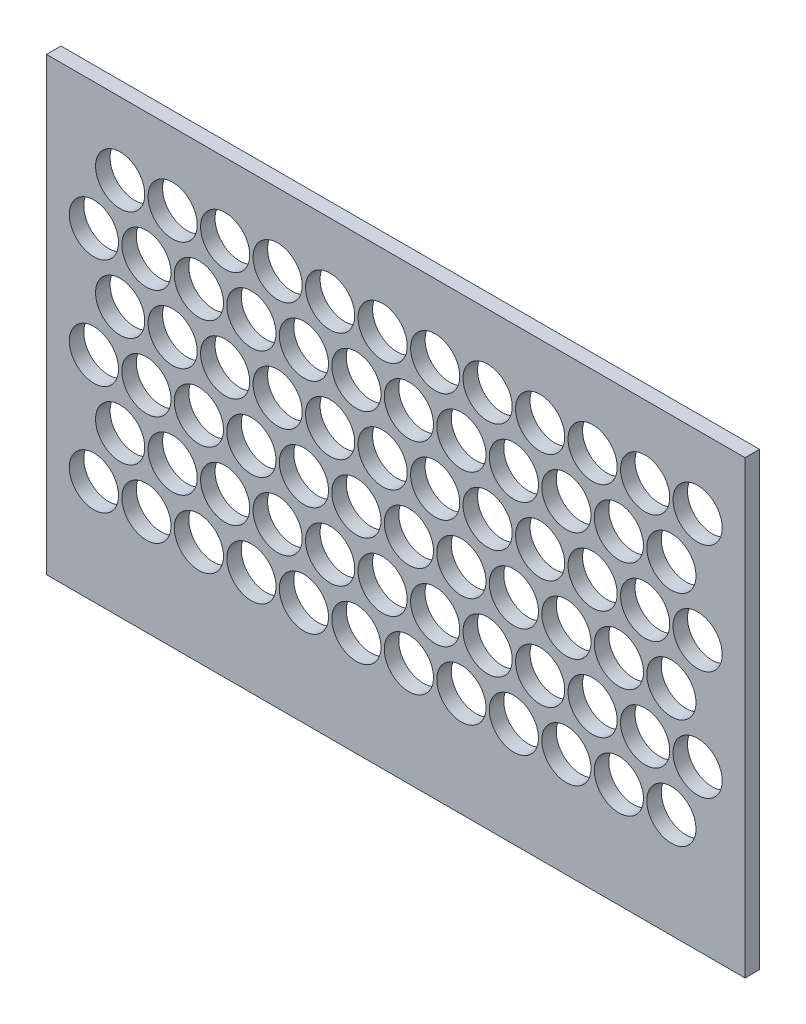
from build123d import *

# Parameters (mm, degrees)
SKETCH1_W                  = 306.05000007
SKETCH1_H                  = 197.4250001
BOSS_EXTRUDE1_DEPTH        = 6.35
CUT_EXTRUDE1_DEPTH         = 187.132543615
SKETCH4_R                  = 10.775
CUT_EXTRUDE2_DEPTH         = 187.132543615
LPATTERN1_COUNT            = 12
LPATTERN1_PITCH            = 23
LPATTERN2_COPY_1_DEPTH     = 187.132543615
LPATTERN2_COPY_2_DEPTH     = 187.132543615
LPATTERN2_COPY_3_DEPTH     = 187.132543615
LPATTERN2_COPY_4_DEPTH     = 187.132543615
LPATTERN2_COPY_5_DEPTH     = 187.132543615
LPATTERN2_COPY_6_DEPTH     = 187.132543615
LPATTERN2_COPY_7_DEPTH     = 187.132543615
LPATTERN2_COPY_8_DEPTH     = 187.132543615
LPATTERN2_COPY_9_DEPTH     = 187.132543615
LPATTERN2_COPY_10_DEPTH    = 187.132543615
LPATTERN2_COPY_11_DEPTH    = 187.132543615
LPATTERN2_COPY_12_DEPTH    = 187.132543615
LPATTERN2_COPY_13_DEPTH    = 187.132543615
LPATTERN2_COPY_14_DEPTH    = 187.132543615
LPATTERN2_COPY_15_DEPTH    = 187.132543615
LPATTERN2_COPY_16_DEPTH    = 187.132543615
LPATTERN2_COPY_17_DEPTH    = 187.132543615
LPATTERN2_COPY_18_DEPTH    = 187.132543615
LPATTERN2_COPY_19_DEPTH    = 187.132543615
LPATTERN2_COPY_20_DEPTH    = 187.132543615
LPATTERN2_COPY_21_DEPTH    = 187.132543615
LPATTERN2_COPY_22_DEPTH    = 187.132543615
LPATTERN2_COPY_23_SKETCH_R = 10.775
LPATTERN2_COPY_23_DEPTH    = 187.132543615
LPATTERN2_COPY_24_SKETCH_R = 10.775
LPATTERN2_COPY_24_DEPTH    = 187.132543615
LPATTERN2_COPY_25_SKETCH_R = 10.775
LPATTERN2_COPY_25_DEPTH    = 187.132543615
LPATTERN2_COPY_26_SKETCH_R = 10.775
LPATTERN2_COPY_26_DEPTH    = 187.132543615
LPATTERN2_COPY_27_SKETCH_R = 10.775
LPATTERN2_COPY_27_DEPTH    = 187.132543615
LPATTERN2_COPY_28_SKETCH_R = 10.775
LPATTERN2_COPY_28_DEPTH    = 187.132543615
LPATTERN2_COPY_29_SKETCH_R = 10.775
LPATTERN2_COPY_29_DEPTH    = 187.132543615
LPATTERN2_COPY_30_SKETCH_R = 10.775
LPATTERN2_COPY_30_DEPTH    = 187.132543615
LPATTERN2_COPY_31_SKETCH_R = 10.775
LPATTERN2_COPY_31_DEPTH    = 187.132543615
LPATTERN2_COPY_32_SKETCH_R = 10.775
LPATTERN2_COPY_32_DEPTH    = 187.132543615
LPATTERN2_COPY_33_SKETCH_R = 10.775
LPATTERN2_COPY_33_DEPTH    = 187.132543615
LPATTERN2_COPY_34_SKETCH_R = 10.775
LPATTERN2_COPY_34_DEPTH    = 187.132543615
LPATTERN2_COPY_35_SKETCH_R = 10.775
LPATTERN2_COPY_35_DEPTH    = 187.132543615
LPATTERN2_COPY_36_SKETCH_R = 10.775
LPATTERN2_COPY_36_DEPTH    = 187.132543615
LPATTERN2_COPY_37_SKETCH_R = 10.775
LPATTERN2_COPY_37_DEPTH    = 187.132543615
LPATTERN2_COPY_38_SKETCH_R = 10.775
LPATTERN2_COPY_38_DEPTH    = 187.132543615
LPATTERN2_COPY_39_SKETCH_R = 10.775
LPATTERN2_COPY_39_DEPTH    = 187.132543615
LPATTERN2_COPY_40_SKETCH_R = 10.775
LPATTERN2_COPY_40_DEPTH    = 187.132543615
LPATTERN2_COPY_41_SKETCH_R = 10.775
LPATTERN2_COPY_41_DEPTH    = 187.132543615
LPATTERN2_COPY_42_SKETCH_R = 10.775
LPATTERN2_COPY_42_DEPTH    = 187.132543615
LPATTERN2_COPY_43_SKETCH_R = 10.775
LPATTERN2_COPY_43_DEPTH    = 187.132543615
LPATTERN2_COPY_44_SKETCH_R = 10.775
LPATTERN2_COPY_44_DEPTH    = 187.132543615
LPATTERN2_COPY_45_DEPTH    = 187.132543615
LPATTERN2_COPY_46_DEPTH    = 187.132543615
LPATTERN2_COPY_47_SKETCH_R = 10.775
LPATTERN2_COPY_47_DEPTH    = 187.132543615
LPATTERN2_COPY_48_SKETCH_R = 10.775
LPATTERN2_COPY_48_DEPTH    = 187.132543615


with BuildPart() as part:
    # Sketch1 → Boss-Extrude1 (new body)
    with BuildSketch(Plane.XY):
        with Locations((3.5e-08, -7.06250005)):
            Rectangle(SKETCH1_W, SKETCH1_H)
    extrude(amount=BOSS_EXTRUDE1_DEPTH)

    # Sketch3 → Cut-Extrude1 (cut, through all)
    with BuildSketch(Plane.XY.offset(6.35)):
        with BuildLine():
            ThreePointArc((-121.475, -60), (-132.24999993, -49.225), (-143.025, -59.999999859))
            ThreePointArc((-143.025, -59.999999859), (-139.869075617, -67.619075517), (-132.25, -70.775))
            ThreePointArc((-132.25, -70.775), (-124.630924433, -67.619075567), (-121.475, -60))
        make_face()
    cut_extrude1 = extrude(amount=-CUT_EXTRUDE1_DEPTH, mode=Mode.SUBTRACT)

    # Sketch4 → Cut-Extrude2 (cut, through all)
    with BuildSketch(Plane.XY.offset(6.35)):
        with Locations((-120.75, -36)):
            Circle(SKETCH4_R)
    cut_extrude2 = extrude(amount=-CUT_EXTRUDE2_DEPTH, mode=Mode.SUBTRACT)

    # LPattern1: Cut-Extrude1, Cut-Extrude2 ×12
    with Locations(*[(i * LPATTERN1_PITCH, 0, 0) for i in range(1, LPATTERN1_COUNT)]):
        add(cut_extrude1, mode=Mode.SUBTRACT)
        add(cut_extrude2, mode=Mode.SUBTRACT)

    # LPattern2 copy 1 sketch → LPattern2 copy 1 (cut, through all)
    with BuildSketch(Plane(origin=(23, 48, 6.35), x_dir=(1, 0, 0), z_dir=(0, 0, 1))):
        with BuildLine():
            ThreePointArc((-121.475, -60), (-132.24999993, -49.225), (-143.025, -59.999999859))
            ThreePointArc((-143.025, -59.999999859), (-139.869075617, -67.619075517), (-132.25, -70.775))
            ThreePointArc((-132.25, -70.775), (-124.630924433, -67.619075567), (-121.475, -60))
        make_face()
    extrude(amount=-LPATTERN2_COPY_1_DEPTH, mode=Mode.SUBTRACT)

    # LPattern2 copy 2 sketch → LPattern2 copy 2 (cut, through all)
    with BuildSketch(Plane(origin=(23, 96, 6.35), x_dir=(1, 0, 0), z_dir=(0, 0, 1))):
        with BuildLine():
            ThreePointArc((-121.475, -60), (-132.24999993, -49.225), (-143.025, -59.999999859))
            ThreePointArc((-143.025, -59.999999859), (-139.869075617, -67.619075517), (-132.25, -70.775))
            ThreePointArc((-132.25, -70.775), (-124.630924433, -67.619075567), (-121.475, -60))
        make_face()
    extrude(amount=-LPATTERN2_COPY_2_DEPTH, mode=Mode.SUBTRACT)

    # LPattern2 copy 3 sketch → LPattern2 copy 3 (cut, through all)
    with BuildSketch(Plane(origin=(46, 48, 6.35), x_dir=(1, 0, 0), z_dir=(0, 0, 1))):
        with BuildLine():
            ThreePointArc((-121.475, -60), (-132.24999993, -49.225), (-143.025, -59.999999859))
            ThreePointArc((-143.025, -59.999999859), (-139.869075617, -67.619075517), (-132.25, -70.775))
            ThreePointArc((-132.25, -70.775), (-124.630924433, -67.619075567), (-121.475, -60))
        make_face()
    extrude(amount=-LPATTERN2_COPY_3_DEPTH, mode=Mode.SUBTRACT)

    # LPattern2 copy 4 sketch → LPattern2 copy 4 (cut, through all)
    with BuildSketch(Plane(origin=(46, 96, 6.35), x_dir=(1, 0, 0), z_dir=(0, 0, 1))):
        with BuildLine():
            ThreePointArc((-121.475, -60), (-132.24999993, -49.225), (-143.025, -59.999999859))
            ThreePointArc((-143.025, -59.999999859), (-139.869075617, -67.619075517), (-132.25, -70.775))
            ThreePointArc((-132.25, -70.775), (-124.630924433, -67.619075567), (-121.475, -60))
        make_face()
    extrude(amount=-LPATTERN2_COPY_4_DEPTH, mode=Mode.SUBTRACT)

    # LPattern2 copy 5 sketch → LPattern2 copy 5 (cut, through all)
    with BuildSketch(Plane(origin=(69, 48, 6.35), x_dir=(1, 0, 0), z_dir=(0, 0, 1))):
        with BuildLine():
            ThreePointArc((-121.475, -60), (-132.24999993, -49.225), (-143.025, -59.999999859))
            ThreePointArc((-143.025, -59.999999859), (-139.869075617, -67.619075517), (-132.25, -70.775))
            ThreePointArc((-132.25, -70.775), (-124.630924433, -67.619075567), (-121.475, -60))
        make_face()
    extrude(amount=-LPATTERN2_COPY_5_DEPTH, mode=Mode.SUBTRACT)

    # LPattern2 copy 6 sketch → LPattern2 copy 6 (cut, through all)
    with BuildSketch(Plane(origin=(69, 96, 6.35), x_dir=(1, 0, 0), z_dir=(0, 0, 1))):
        with BuildLine():
            ThreePointArc((-121.475, -60), (-132.24999993, -49.225), (-143.025, -59.999999859))
            ThreePointArc((-143.025, -59.999999859), (-139.869075617, -67.619075517), (-132.25, -70.775))
            ThreePointArc((-132.25, -70.775), (-124.630924433, -67.619075567), (-121.475, -60))
        make_face()
    extrude(amount=-LPATTERN2_COPY_6_DEPTH, mode=Mode.SUBTRACT)

    # LPattern2 copy 7 sketch → LPattern2 copy 7 (cut, through all)
    with BuildSketch(Plane(origin=(92, 48, 6.35), x_dir=(1, 0, 0), z_dir=(0, 0, 1))):
        with BuildLine():
            ThreePointArc((-121.475, -60), (-132.24999993, -49.225), (-143.025, -59.999999859))
            ThreePointArc((-143.025, -59.999999859), (-139.869075617, -67.619075517), (-132.25, -70.775))
            ThreePointArc((-132.25, -70.775), (-124.630924433, -67.619075567), (-121.475, -60))
        make_face()
    extrude(amount=-LPATTERN2_COPY_7_DEPTH, mode=Mode.SUBTRACT)

    # LPattern2 copy 8 sketch → LPattern2 copy 8 (cut, through all)
    with BuildSketch(Plane(origin=(92, 96, 6.35), x_dir=(1, 0, 0), z_dir=(0, 0, 1))):
        with BuildLine():
            ThreePointArc((-121.475, -60), (-132.24999993, -49.225), (-143.025, -59.999999859))
            ThreePointArc((-143.025, -59.999999859), (-139.869075617, -67.619075517), (-132.25, -70.775))
            ThreePointArc((-132.25, -70.775), (-124.630924433, -67.619075567), (-121.475, -60))
        make_face()
    extrude(amount=-LPATTERN2_COPY_8_DEPTH, mode=Mode.SUBTRACT)

    # LPattern2 copy 9 sketch → LPattern2 copy 9 (cut, through all)
    with BuildSketch(Plane(origin=(115, 48, 6.35), x_dir=(1, 0, 0), z_dir=(0, 0, 1))):
        with BuildLine():
            ThreePointArc((-121.475, -60), (-132.24999993, -49.225), (-143.025, -59.999999859))
            ThreePointArc((-143.025, -59.999999859), (-139.869075617, -67.619075517), (-132.25, -70.775))
            ThreePointArc((-132.25, -70.775), (-124.630924433, -67.619075567), (-121.475, -60))
        make_face()
    extrude(amount=-LPATTERN2_COPY_9_DEPTH, mode=Mode.SUBTRACT)

    # LPattern2 copy 10 sketch → LPattern2 copy 10 (cut, through all)
    with BuildSketch(Plane(origin=(115, 96, 6.35), x_dir=(1, 0, 0), z_dir=(0, 0, 1))):
        with BuildLine():
            ThreePointArc((-121.475, -60), (-132.24999993, -49.225), (-143.025, -59.999999859))
            ThreePointArc((-143.025, -59.999999859), (-139.869075617, -67.619075517), (-132.25, -70.775))
            ThreePointArc((-132.25, -70.775), (-124.630924433, -67.619075567), (-121.475, -60))
        make_face()
    extrude(amount=-LPATTERN2_COPY_10_DEPTH, mode=Mode.SUBTRACT)

    # LPattern2 copy 11 sketch → LPattern2 copy 11 (cut, through all)
    with BuildSketch(Plane(origin=(138, 48, 6.35), x_dir=(1, 0, 0), z_dir=(0, 0, 1))):
        with BuildLine():
            ThreePointArc((-121.475, -60), (-132.24999993, -49.225), (-143.025, -59.999999859))
            ThreePointArc((-143.025, -59.999999859), (-139.869075617, -67.619075517), (-132.25, -70.775))
            ThreePointArc((-132.25, -70.775), (-124.630924433, -67.619075567), (-121.475, -60))
        make_face()
    extrude(amount=-LPATTERN2_COPY_11_DEPTH, mode=Mode.SUBTRACT)

    # LPattern2 copy 12 sketch → LPattern2 copy 12 (cut, through all)
    with BuildSketch(Plane(origin=(138, 96, 6.35), x_dir=(1, 0, 0), z_dir=(0, 0, 1))):
        with BuildLine():
            ThreePointArc((-121.475, -60), (-132.24999993, -49.225), (-143.025, -59.999999859))
            ThreePointArc((-143.025, -59.999999859), (-139.869075617, -67.619075517), (-132.25, -70.775))
            ThreePointArc((-132.25, -70.775), (-124.630924433, -67.619075567), (-121.475, -60))
        make_face()
    extrude(amount=-LPATTERN2_COPY_12_DEPTH, mode=Mode.SUBTRACT)

    # LPattern2 copy 13 sketch → LPattern2 copy 13 (cut, through all)
    with BuildSketch(Plane(origin=(161, 48, 6.35), x_dir=(1, 0, 0), z_dir=(0, 0, 1))):
        with BuildLine():
            ThreePointArc((-121.475, -60), (-132.24999993, -49.225), (-143.025, -59.999999859))
            ThreePointArc((-143.025, -59.999999859), (-139.869075617, -67.619075517), (-132.25, -70.775))
            ThreePointArc((-132.25, -70.775), (-124.630924433, -67.619075567), (-121.475, -60))
        make_face()
    extrude(amount=-LPATTERN2_COPY_13_DEPTH, mode=Mode.SUBTRACT)

    # LPattern2 copy 14 sketch → LPattern2 copy 14 (cut, through all)
    with BuildSketch(Plane(origin=(161, 96, 6.35), x_dir=(1, 0, 0), z_dir=(0, 0, 1))):
        with BuildLine():
            ThreePointArc((-121.475, -60), (-132.24999993, -49.225), (-143.025, -59.999999859))
            ThreePointArc((-143.025, -59.999999859), (-139.869075617, -67.619075517), (-132.25, -70.775))
            ThreePointArc((-132.25, -70.775), (-124.630924433, -67.619075567), (-121.475, -60))
        make_face()
    extrude(amount=-LPATTERN2_COPY_14_DEPTH, mode=Mode.SUBTRACT)

    # LPattern2 copy 15 sketch → LPattern2 copy 15 (cut, through all)
    with BuildSketch(Plane(origin=(184, 48, 6.35), x_dir=(1, 0, 0), z_dir=(0, 0, 1))):
        with BuildLine():
            ThreePointArc((-121.475, -60), (-132.24999993, -49.225), (-143.025, -59.999999859))
            ThreePointArc((-143.025, -59.999999859), (-139.869075617, -67.619075517), (-132.25, -70.775))
            ThreePointArc((-132.25, -70.775), (-124.630924433, -67.619075567), (-121.475, -60))
        make_face()
    extrude(amount=-LPATTERN2_COPY_15_DEPTH, mode=Mode.SUBTRACT)

    # LPattern2 copy 16 sketch → LPattern2 copy 16 (cut, through all)
    with BuildSketch(Plane(origin=(184, 96, 6.35), x_dir=(1, 0, 0), z_dir=(0, 0, 1))):
        with BuildLine():
            ThreePointArc((-121.475, -60), (-132.24999993, -49.225), (-143.025, -59.999999859))
            ThreePointArc((-143.025, -59.999999859), (-139.869075617, -67.619075517), (-132.25, -70.775))
            ThreePointArc((-132.25, -70.775), (-124.630924433, -67.619075567), (-121.475, -60))
        make_face()
    extrude(amount=-LPATTERN2_COPY_16_DEPTH, mode=Mode.SUBTRACT)

    # LPattern2 copy 17 sketch → LPattern2 copy 17 (cut, through all)
    with BuildSketch(Plane(origin=(207, 48, 6.35), x_dir=(1, 0, 0), z_dir=(0, 0, 1))):
        with BuildLine():
            ThreePointArc((-121.475, -60), (-132.24999993, -49.225), (-143.025, -59.999999859))
            ThreePointArc((-143.025, -59.999999859), (-139.869075617, -67.619075517), (-132.25, -70.775))
            ThreePointArc((-132.25, -70.775), (-124.630924433, -67.619075567), (-121.475, -60))
        make_face()
    extrude(amount=-LPATTERN2_COPY_17_DEPTH, mode=Mode.SUBTRACT)

    # LPattern2 copy 18 sketch → LPattern2 copy 18 (cut, through all)
    with BuildSketch(Plane(origin=(207, 96, 6.35), x_dir=(1, 0, 0), z_dir=(0, 0, 1))):
        with BuildLine():
            ThreePointArc((-121.475, -60), (-132.24999993, -49.225), (-143.025, -59.999999859))
            ThreePointArc((-143.025, -59.999999859), (-139.869075617, -67.619075517), (-132.25, -70.775))
            ThreePointArc((-132.25, -70.775), (-124.630924433, -67.619075567), (-121.475, -60))
        make_face()
    extrude(amount=-LPATTERN2_COPY_18_DEPTH, mode=Mode.SUBTRACT)

    # LPattern2 copy 19 sketch → LPattern2 copy 19 (cut, through all)
    with BuildSketch(Plane(origin=(230, 48, 6.35), x_dir=(1, 0, 0), z_dir=(0, 0, 1))):
        with BuildLine():
            ThreePointArc((-121.475, -60), (-132.24999993, -49.225), (-143.025, -59.999999859))
            ThreePointArc((-143.025, -59.999999859), (-139.869075617, -67.619075517), (-132.25, -70.775))
            ThreePointArc((-132.25, -70.775), (-124.630924433, -67.619075567), (-121.475, -60))
        make_face()
    extrude(amount=-LPATTERN2_COPY_19_DEPTH, mode=Mode.SUBTRACT)

    # LPattern2 copy 20 sketch → LPattern2 copy 20 (cut, through all)
    with BuildSketch(Plane(origin=(230, 96, 6.35), x_dir=(1, 0, 0), z_dir=(0, 0, 1))):
        with BuildLine():
            ThreePointArc((-121.475, -60), (-132.24999993, -49.225), (-143.025, -59.999999859))
            ThreePointArc((-143.025, -59.999999859), (-139.869075617, -67.619075517), (-132.25, -70.775))
            ThreePointArc((-132.25, -70.775), (-124.630924433, -67.619075567), (-121.475, -60))
        make_face()
    extrude(amount=-LPATTERN2_COPY_20_DEPTH, mode=Mode.SUBTRACT)

    # LPattern2 copy 21 sketch → LPattern2 copy 21 (cut, through all)
    with BuildSketch(Plane(origin=(253, 48, 6.35), x_dir=(1, 0, 0), z_dir=(0, 0, 1))):
        with BuildLine():
            ThreePointArc((-121.475, -60), (-132.24999993, -49.225), (-143.025, -59.999999859))
            ThreePointArc((-143.025, -59.999999859), (-139.869075617, -67.619075517), (-132.25, -70.775))
            ThreePointArc((-132.25, -70.775), (-124.630924433, -67.619075567), (-121.475, -60))
        make_face()
    extrude(amount=-LPATTERN2_COPY_21_DEPTH, mode=Mode.SUBTRACT)

    # LPattern2 copy 22 sketch → LPattern2 copy 22 (cut, through all)
    with BuildSketch(Plane(origin=(253, 96, 6.35), x_dir=(1, 0, 0), z_dir=(0, 0, 1))):
        with BuildLine():
            ThreePointArc((-121.475, -60), (-132.24999993, -49.225), (-143.025, -59.999999859))
            ThreePointArc((-143.025, -59.999999859), (-139.869075617, -67.619075517), (-132.25, -70.775))
            ThreePointArc((-132.25, -70.775), (-124.630924433, -67.619075567), (-121.475, -60))
        make_face()
    extrude(amount=-LPATTERN2_COPY_22_DEPTH, mode=Mode.SUBTRACT)

    # LPattern2 copy 23 sketch → LPattern2 copy 23 (cut, through all)
    with BuildSketch(Plane(origin=(23, 48, 6.35), x_dir=(1, 0, 0), z_dir=(0, 0, 1))):
        with Locations((-120.75, -36)):
            Circle(LPATTERN2_COPY_23_SKETCH_R)
    extrude(amount=-LPATTERN2_COPY_23_DEPTH, mode=Mode.SUBTRACT)

    # LPattern2 copy 24 sketch → LPattern2 copy 24 (cut, through all)
    with BuildSketch(Plane(origin=(23, 96, 6.35), x_dir=(1, 0, 0), z_dir=(0, 0, 1))):
        with Locations((-120.75, -36)):
            Circle(LPATTERN2_COPY_24_SKETCH_R)
    extrude(amount=-LPATTERN2_COPY_24_DEPTH, mode=Mode.SUBTRACT)

    # LPattern2 copy 25 sketch → LPattern2 copy 25 (cut, through all)
    with BuildSketch(Plane(origin=(46, 48, 6.35), x_dir=(1, 0, 0), z_dir=(0, 0, 1))):
        with Locations((-120.75, -36)):
            Circle(LPATTERN2_COPY_25_SKETCH_R)
    extrude(amount=-LPATTERN2_COPY_25_DEPTH, mode=Mode.SUBTRACT)

    # LPattern2 copy 26 sketch → LPattern2 copy 26 (cut, through all)
    with BuildSketch(Plane(origin=(46, 96, 6.35), x_dir=(1, 0, 0), z_dir=(0, 0, 1))):
        with Locations((-120.75, -36)):
            Circle(LPATTERN2_COPY_26_SKETCH_R)
    extrude(amount=-LPATTERN2_COPY_26_DEPTH, mode=Mode.SUBTRACT)

    # LPattern2 copy 27 sketch → LPattern2 copy 27 (cut, through all)
    with BuildSketch(Plane(origin=(69, 48, 6.35), x_dir=(1, 0, 0), z_dir=(0, 0, 1))):
        with Locations((-120.75, -36)):
            Circle(LPATTERN2_COPY_27_SKETCH_R)
    extrude(amount=-LPATTERN2_COPY_27_DEPTH, mode=Mode.SUBTRACT)

    # LPattern2 copy 28 sketch → LPattern2 copy 28 (cut, through all)
    with BuildSketch(Plane(origin=(69, 96, 6.35), x_dir=(1, 0, 0), z_dir=(0, 0, 1))):
        with Locations((-120.75, -36)):
            Circle(LPATTERN2_COPY_28_SKETCH_R)
    extrude(amount=-LPATTERN2_COPY_28_DEPTH, mode=Mode.SUBTRACT)

    # LPattern2 copy 29 sketch → LPattern2 copy 29 (cut, through all)
    with BuildSketch(Plane(origin=(92, 48, 6.35), x_dir=(1, 0, 0), z_dir=(0, 0, 1))):
        with Locations((-120.75, -36)):
            Circle(LPATTERN2_COPY_29_SKETCH_R)
    extrude(amount=-LPATTERN2_COPY_29_DEPTH, mode=Mode.SUBTRACT)

    # LPattern2 copy 30 sketch → LPattern2 copy 30 (cut, through all)
    with BuildSketch(Plane(origin=(92, 96, 6.35), x_dir=(1, 0, 0), z_dir=(0, 0, 1))):
        with Locations((-120.75, -36)):
            Circle(LPATTERN2_COPY_30_SKETCH_R)
    extrude(amount=-LPATTERN2_COPY_30_DEPTH, mode=Mode.SUBTRACT)

    # LPattern2 copy 31 sketch → LPattern2 copy 31 (cut, through all)
    with BuildSketch(Plane(origin=(115, 48, 6.35), x_dir=(1, 0, 0), z_dir=(0, 0, 1))):
        with Locations((-120.75, -36)):
            Circle(LPATTERN2_COPY_31_SKETCH_R)
    extrude(amount=-LPATTERN2_COPY_31_DEPTH, mode=Mode.SUBTRACT)

    # LPattern2 copy 32 sketch → LPattern2 copy 32 (cut, through all)
    with BuildSketch(Plane(origin=(115, 96, 6.35), x_dir=(1, 0, 0), z_dir=(0, 0, 1))):
        with Locations((-120.75, -36)):
            Circle(LPATTERN2_COPY_32_SKETCH_R)
    extrude(amount=-LPATTERN2_COPY_32_DEPTH, mode=Mode.SUBTRACT)

    # LPattern2 copy 33 sketch → LPattern2 copy 33 (cut, through all)
    with BuildSketch(Plane(origin=(138, 48, 6.35), x_dir=(1, 0, 0), z_dir=(0, 0, 1))):
        with Locations((-120.75, -36)):
            Circle(LPATTERN2_COPY_33_SKETCH_R)
    extrude(amount=-LPATTERN2_COPY_33_DEPTH, mode=Mode.SUBTRACT)

    # LPattern2 copy 34 sketch → LPattern2 copy 34 (cut, through all)
    with BuildSketch(Plane(origin=(138, 96, 6.35), x_dir=(1, 0, 0), z_dir=(0, 0, 1))):
        with Locations((-120.75, -36)):
            Circle(LPATTERN2_COPY_34_SKETCH_R)
    extrude(amount=-LPATTERN2_COPY_34_DEPTH, mode=Mode.SUBTRACT)

    # LPattern2 copy 35 sketch → LPattern2 copy 35 (cut, through all)
    with BuildSketch(Plane(origin=(161, 48, 6.35), x_dir=(1, 0, 0), z_dir=(0, 0, 1))):
        with Locations((-120.75, -36)):
            Circle(LPATTERN2_COPY_35_SKETCH_R)
    extrude(amount=-LPATTERN2_COPY_35_DEPTH, mode=Mode.SUBTRACT)

    # LPattern2 copy 36 sketch → LPattern2 copy 36 (cut, through all)
    with BuildSketch(Plane(origin=(161, 96, 6.35), x_dir=(1, 0, 0), z_dir=(0, 0, 1))):
        with Locations((-120.75, -36)):
            Circle(LPATTERN2_COPY_36_SKETCH_R)
    extrude(amount=-LPATTERN2_COPY_36_DEPTH, mode=Mode.SUBTRACT)

    # LPattern2 copy 37 sketch → LPattern2 copy 37 (cut, through all)
    with BuildSketch(Plane(origin=(184, 48, 6.35), x_dir=(1, 0, 0), z_dir=(0, 0, 1))):
        with Locations((-120.75, -36)):
            Circle(LPATTERN2_COPY_37_SKETCH_R)
    extrude(amount=-LPATTERN2_COPY_37_DEPTH, mode=Mode.SUBTRACT)

    # LPattern2 copy 38 sketch → LPattern2 copy 38 (cut, through all)
    with BuildSketch(Plane(origin=(184, 96, 6.35), x_dir=(1, 0, 0), z_dir=(0, 0, 1))):
        with Locations((-120.75, -36)):
            Circle(LPATTERN2_COPY_38_SKETCH_R)
    extrude(amount=-LPATTERN2_COPY_38_DEPTH, mode=Mode.SUBTRACT)

    # LPattern2 copy 39 sketch → LPattern2 copy 39 (cut, through all)
    with BuildSketch(Plane(origin=(207, 48, 6.35), x_dir=(1, 0, 0), z_dir=(0, 0, 1))):
        with Locations((-120.75, -36)):
            Circle(LPATTERN2_COPY_39_SKETCH_R)
    extrude(amount=-LPATTERN2_COPY_39_DEPTH, mode=Mode.SUBTRACT)

    # LPattern2 copy 40 sketch → LPattern2 copy 40 (cut, through all)
    with BuildSketch(Plane(origin=(207, 96, 6.35), x_dir=(1, 0, 0), z_dir=(0, 0, 1))):
        with Locations((-120.75, -36)):
            Circle(LPATTERN2_COPY_40_SKETCH_R)
    extrude(amount=-LPATTERN2_COPY_40_DEPTH, mode=Mode.SUBTRACT)

    # LPattern2 copy 41 sketch → LPattern2 copy 41 (cut, through all)
    with BuildSketch(Plane(origin=(230, 48, 6.35), x_dir=(1, 0, 0), z_dir=(0, 0, 1))):
        with Locations((-120.75, -36)):
            Circle(LPATTERN2_COPY_41_SKETCH_R)
    extrude(amount=-LPATTERN2_COPY_41_DEPTH, mode=Mode.SUBTRACT)

    # LPattern2 copy 42 sketch → LPattern2 copy 42 (cut, through all)
    with BuildSketch(Plane(origin=(230, 96, 6.35), x_dir=(1, 0, 0), z_dir=(0, 0, 1))):
        with Locations((-120.75, -36)):
            Circle(LPATTERN2_COPY_42_SKETCH_R)
    extrude(amount=-LPATTERN2_COPY_42_DEPTH, mode=Mode.SUBTRACT)

    # LPattern2 copy 43 sketch → LPattern2 copy 43 (cut, through all)
    with BuildSketch(Plane(origin=(253, 48, 6.35), x_dir=(1, 0, 0), z_dir=(0, 0, 1))):
        with Locations((-120.75, -36)):
            Circle(LPATTERN2_COPY_43_SKETCH_R)
    extrude(amount=-LPATTERN2_COPY_43_DEPTH, mode=Mode.SUBTRACT)

    # LPattern2 copy 44 sketch → LPattern2 copy 44 (cut, through all)
    with BuildSketch(Plane(origin=(253, 96, 6.35), x_dir=(1, 0, 0), z_dir=(0, 0, 1))):
        with Locations((-120.75, -36)):
            Circle(LPATTERN2_COPY_44_SKETCH_R)
    extrude(amount=-LPATTERN2_COPY_44_DEPTH, mode=Mode.SUBTRACT)

    # LPattern2 copy 45 sketch → LPattern2 copy 45 (cut, through all)
    with BuildSketch(Plane(origin=(0, 48, 6.35), x_dir=(1, 0, 0), z_dir=(0, 0, 1))):
        with BuildLine():
            ThreePointArc((-121.475, -60), (-132.24999993, -49.225), (-143.025, -59.999999859))
            ThreePointArc((-143.025, -59.999999859), (-139.869075617, -67.619075517), (-132.25, -70.775))
            ThreePointArc((-132.25, -70.775), (-124.630924433, -67.619075567), (-121.475, -60))
        make_face()
    extrude(amount=-LPATTERN2_COPY_45_DEPTH, mode=Mode.SUBTRACT)

    # LPattern2 copy 46 sketch → LPattern2 copy 46 (cut, through all)
    with BuildSketch(Plane(origin=(0, 96, 6.35), x_dir=(1, 0, 0), z_dir=(0, 0, 1))):
        with BuildLine():
            ThreePointArc((-121.475, -60), (-132.24999993, -49.225), (-143.025, -59.999999859))
            ThreePointArc((-143.025, -59.999999859), (-139.869075617, -67.619075517), (-132.25, -70.775))
            ThreePointArc((-132.25, -70.775), (-124.630924433, -67.619075567), (-121.475, -60))
        make_face()
    extrude(amount=-LPATTERN2_COPY_46_DEPTH, mode=Mode.SUBTRACT)

    # LPattern2 copy 47 sketch → LPattern2 copy 47 (cut, through all)
    with BuildSketch(Plane(origin=(0, 48, 6.35), x_dir=(1, 0, 0), z_dir=(0, 0, 1))):
        with Locations((-120.75, -36)):
            Circle(LPATTERN2_COPY_47_SKETCH_R)
    extrude(amount=-LPATTERN2_COPY_47_DEPTH, mode=Mode.SUBTRACT)

    # LPattern2 copy 48 sketch → LPattern2 copy 48 (cut, through all)
    with BuildSketch(Plane(origin=(0, 96, 6.35), x_dir=(1, 0, 0), z_dir=(0, 0, 1))):
        with Locations((-120.75, -36)):
            Circle(LPATTERN2_COPY_48_SKETCH_R)
    extrude(amount=-LPATTERN2_COPY_48_DEPTH, mode=Mode.SUBTRACT)


solid = part.part
